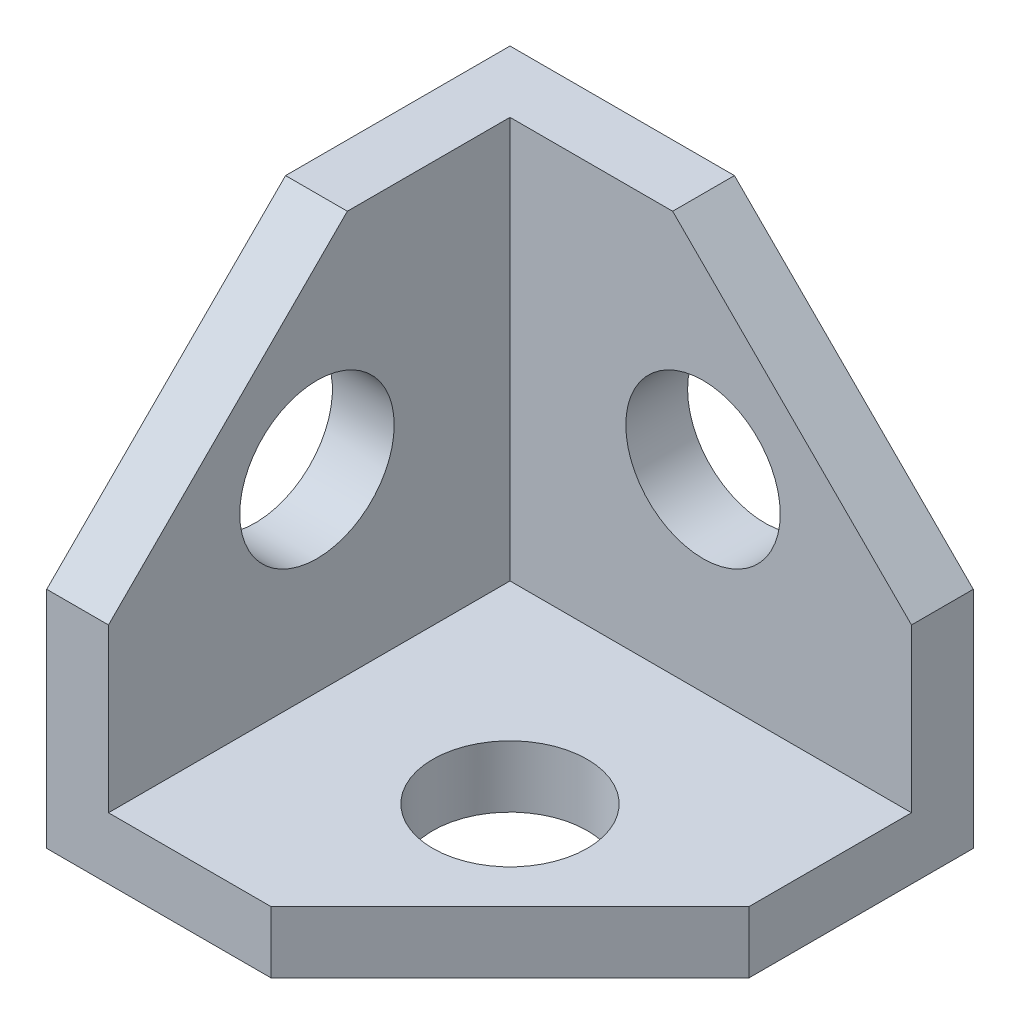
from build123d import *

# Parameters (mm, degrees)
BOSS_EXTRUDE1_DEPTH          = 2.4
SKETCH2_W                    = 15.6
SKETCH2_H                    = 2.4
BOSS_EXTRUDE2_DEPTH          = 6.32
BOSS_EXTRUDE3_DEPTH          = 2.4
BOSS_EXTRUDE4_DEPTH          = 2.4
F_6_0_6_DIAMETER_HOLE1_D     = 6
F_6_0_6_DIAMETER_HOLE1_DEPTH = 18.00005
F_6_0_6_DIAMETER_HOLE2_D     = 6
F_6_0_6_DIAMETER_HOLE2_DEPTH = 18.00005
F_6_0_6_DIAMETER_HOLE3_D     = 6
F_6_0_6_DIAMETER_HOLE3_DEPTH = 18.00005


with BuildPart() as part:
    # Boss-Extrude1: read off the stored shape, not the designer's step
    # Boss-Extrude1 outline → Boss-Extrude1 (new body)
    with BuildSketch(Plane(origin=(0, 0, 0), x_dir=(1, 0, 0), z_dir=(0, 1, 0))):
        Polygon((2.4, -18), (8.72, -18), (18, -8.72), (2.4, -8.72), align=None)
    extrude(amount=BOSS_EXTRUDE1_DEPTH)

    # Sketch2 → Boss-Extrude2 (add)
    with BuildSketch(Plane(origin=(0, 0, 8.72), x_dir=(-1, 0, 0), z_dir=(0, 0, -1))):
        with Locations((-10.2, 1.2)):
            Rectangle(SKETCH2_W, SKETCH2_H)
    extrude(amount=BOSS_EXTRUDE2_DEPTH)

    # Sketch3 → Boss-Extrude3 (add)
    with BuildSketch(Plane(origin=(0, 0, 2.4), x_dir=(-1, 0, 0), z_dir=(0, 0, -1))):
        Polygon((-2.4, 0), (-18, 0), (-18, 8.72), (-8.72, 18), (-2.4, 18), align=None)
    extrude(amount=BOSS_EXTRUDE3_DEPTH)

    # Sketch4 → Boss-Extrude4 (add)
    with BuildSketch(Plane.ZY.offset(-2.4)):
        Polygon((0, 18), (8.72, 18), (18, 8.72), (18, 0), (0, 0), align=None)
    extrude(amount=BOSS_EXTRUDE4_DEPTH)

    # Ø6.0 (6) Diameter Hole1
    with Locations(Plane.ZY):
        with Locations((9.9, 9.9)):
            Hole(F_6_0_6_DIAMETER_HOLE1_D / 2, depth=F_6_0_6_DIAMETER_HOLE1_DEPTH)

    # Ø6.0 (6) Diameter Hole2
    with Locations(Plane(origin=(0, 0, 0), x_dir=(-1, 0, 0), z_dir=(0, 0, -1))):
        with Locations((-9.9, 9.9)):
            Hole(F_6_0_6_DIAMETER_HOLE2_D / 2, depth=F_6_0_6_DIAMETER_HOLE2_DEPTH)

    # Ø6.0 (6) Diameter Hole3
    with Locations(Plane(origin=(0, 0, 0), x_dir=(-1, 0, 0), z_dir=(0, -1, 0))):
        with Locations((-9.9, -9.9)):
            Hole(F_6_0_6_DIAMETER_HOLE3_D / 2, depth=F_6_0_6_DIAMETER_HOLE3_DEPTH)


solid = part.part
